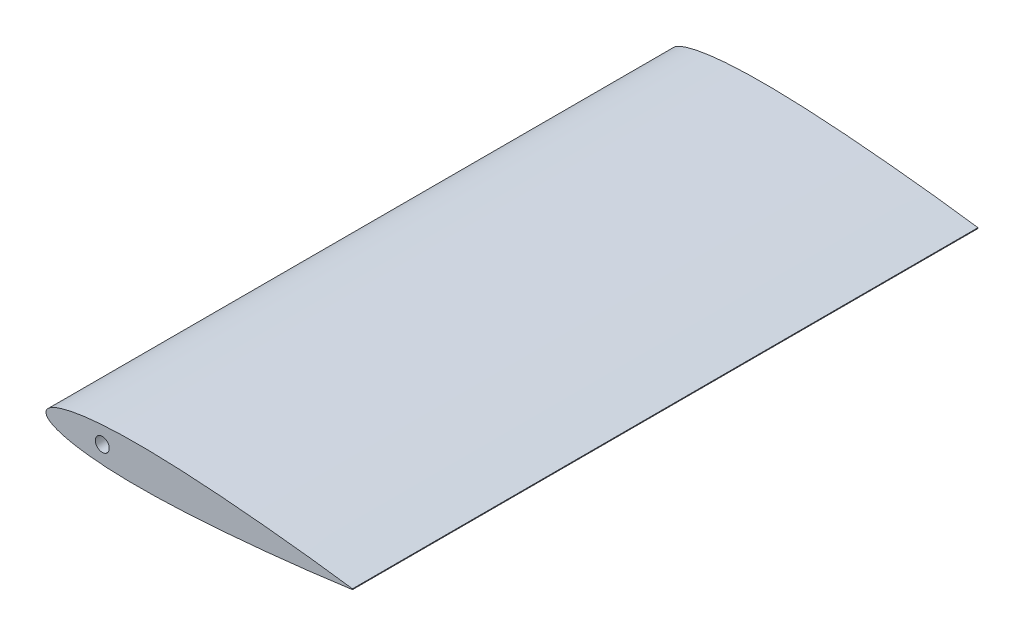
from build123d import *

# Parameters (mm, degrees)
BOSS_EXTRUDE4_DEPTH = 90
SKETCH8_R           = 1
CUT_EXTRUDE3_DEPTH  = 100.824232827


with BuildPart() as part:
    # Sketch7 → Boss-Extrude4 (new body)
    with BuildSketch(Plane.XY):
        with BuildLine():
            Line((1, -0.10458), (1, 0.006552))
            add(Edge.make_bspline(
                [(1, 0.006552), (0.158660801, 0.124727465), (-3.011604778, 0.553296947), (-7.426296131, 1.078650664), (-12.698984729, 1.622280872), (-16.696954397, 1.979309879), (-20.519318828, 2.259526479), (-23.687785093, 2.44374322), (-26.801187498, 2.56579063), (-29.794387909, 2.612172186), (-32.327162109, 2.576446202), (-34.397744397, 2.482512421), (-36.022113664, 2.36180268), (-37.507030652, 2.200553443), (-38.649022039, 2.029716932), (-39.481499593, 1.872022936), (-40.043713025, 1.748908125), (-40.561648345, 1.617733024), (-41.03416108, 1.479085277), (-41.460209338, 1.333425332), (-41.838884549, 1.181256266), (-42.169437107, 1.023017059), (-42.451237267, 0.859037156), (-42.683956884, 0.689594536), (-42.867146282, 0.514410475), (-43.000363693, 0.332988706), (-43.081813028, 0.144442461), (-43.108865092, -0.049014), (-43.081813028, -0.242470461), (-43.000363693, -0.431016706), (-42.867146282, -0.612438475), (-42.683956884, -0.787622536), (-42.451237267, -0.957065156), (-42.169437107, -1.121045059), (-41.838884549, -1.279284266), (-41.460209338, -1.431453332), (-41.03416108, -1.577113277), (-40.561648345, -1.715761024), (-40.043713025, -1.846936125), (-39.267976452, -2.016808732), (-38.192881528, -2.203621226), (-36.782881985, -2.384099047), (-34.930256604, -2.552209464), (-32.604733745, -2.670438773), (-29.449317016, -2.715075555), (-26.102193865, -2.645860532), (-22.634490798, -2.486549808), (-19.462407721, -2.284880754), (-15.994268713, -2.015630673), (-12.955274596, -1.739321086), (-9.038563577, -1.346632899), (-5.164689643, -0.91339158), (-1.466486188, -0.443611539), (0.380454215, -0.191304711), (0.922875159, -0.115413043), (1, -0.10458)],
                knots=[0, 0, 0, 0, 0.028342901, 0.106722049, 0.148306055, 0.205171367, 0.2406214, 0.276160573, 0.311047092, 0.344559266, 0.37601757, 0.395537659, 0.413698812, 0.430349273, 0.445356904, 0.452209372, 0.458611567, 0.464554044, 0.47002985, 0.475034902, 0.479569141, 0.483636857, 0.487250263, 0.490431338, 0.493218828, 0.495674086, 0.497891368, 0.5, 0.502108632, 0.504325914, 0.506781172, 0.509568662, 0.512749737, 0.516363143, 0.520430859, 0.524965098, 0.52997015, 0.535445956, 0.541388433, 0.547790628, 0.561933981, 0.577778559, 0.595202024, 0.62398243, 0.655440734, 0.700464146, 0.735649713, 0.771241831, 0.806495957, 0.851693945, 0.873039495, 0.937813387, 0.981728388, 0.997401831, 1, 1, 1, 1], degree=3))
        make_face()
    extrude(amount=BOSS_EXTRUDE4_DEPTH)

    # Sketch8 → Cut-Extrude3 (cut, through all)
    with BuildSketch(Plane.XY.offset(90)):
        with Locations((-35, 0)):
            Circle(SKETCH8_R)
    extrude(amount=-CUT_EXTRUDE3_DEPTH, mode=Mode.SUBTRACT)


solid = part.part
